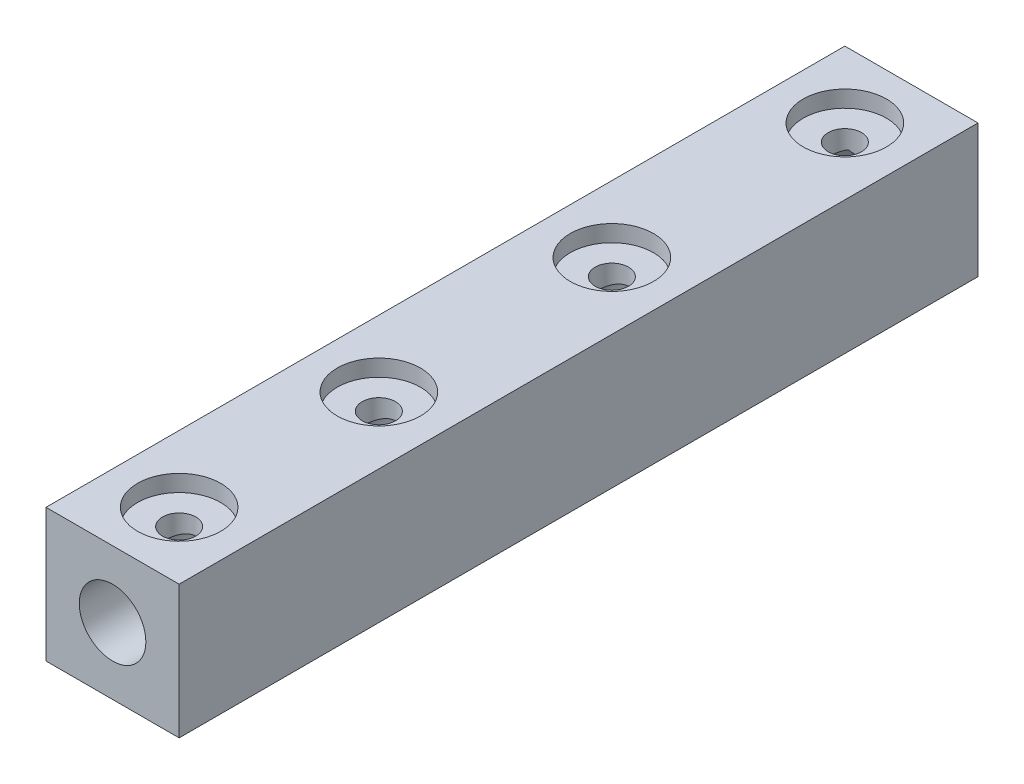
from build123d import *

# Parameters (mm, degrees)
SKETCH18_W                     = 25.4
SKETCH18_H                     = 25.4
BOSS_EXTRUDE3_DEPTH            = 76.2
F_1_2_0_5_DIAMETER_HOLE2_D     = 12.7
F_1_2_0_5_DIAMETER_HOLE2_DEPTH = 142.234535069
F_1_2_0_5_DIAMETER_HOLE2_TIP   = 3.815464931
SKETCH26_R                     = 3.175
CUT_EXTRUDE10_DEPTH            = 12.7
SKETCH27_R                     = 7.9375
CUT_EXTRUDE11_DEPTH            = 3.175
CUT_EXTRUDE12_START            = -12.7
SKETCH28_R                     = 3.175
CUT_EXTRUDE12_DEPTH            = 12.7
CUT_EXTRUDE13_START            = -3.175
SKETCH29_R                     = 7.9375
CUT_EXTRUDE13_DEPTH            = 3.175


with BuildPart() as part:
    # Sketch18 → Boss-Extrude3 (new, symmetric)
    with BuildSketch(Plane.XY):
        Rectangle(SKETCH18_W, SKETCH18_H)
    extrude(amount=BOSS_EXTRUDE3_DEPTH, both=True)

    # 1/2 (0.5) Diameter Hole2
    with Locations(Plane.XY.offset(76.2)):
        with Locations((0, 0)):
            Hole(F_1_2_0_5_DIAMETER_HOLE2_D / 2, depth=F_1_2_0_5_DIAMETER_HOLE2_DEPTH)
            with Locations((0, 0, -(F_1_2_0_5_DIAMETER_HOLE2_DEPTH + F_1_2_0_5_DIAMETER_HOLE2_TIP / 2))):  # 118° drill point
                Cone(0, F_1_2_0_5_DIAMETER_HOLE2_D / 2, F_1_2_0_5_DIAMETER_HOLE2_TIP, mode=Mode.SUBTRACT)

    # Sketch26 → Cut-Extrude10 (cut)
    with BuildSketch(Plane(origin=(0, 12.7, 0), x_dir=(1, 0, 0), z_dir=(0, 1, 0))):
        with Locations((0, -63.5)):
            Circle(SKETCH26_R)
        with Locations((0, -25.4)):
            Circle(SKETCH26_R)
        with Locations((0, 19.05)):
            Circle(SKETCH26_R)
        with Locations((0, 63.5)):
            Circle(SKETCH26_R)
    extrude(amount=-CUT_EXTRUDE10_DEPTH, mode=Mode.SUBTRACT)

    # Sketch27 → Cut-Extrude11 (cut)
    with BuildSketch(Plane(origin=(0, 12.7, 0), x_dir=(1, 0, 0), z_dir=(0, 1, 0))):
        with Locations((0, 63.5)):
            Circle(SKETCH27_R)
        with Locations((0, 19.05)):
            Circle(SKETCH27_R)
        with Locations((0, -25.4)):
            Circle(SKETCH27_R)
        with Locations((0, -63.5)):
            Circle(SKETCH27_R)
    extrude(amount=-CUT_EXTRUDE11_DEPTH, mode=Mode.SUBTRACT)

    # Sketch28 → Cut-Extrude12 (cut)
    with BuildSketch(Plane.XZ.offset(12.7).offset(CUT_EXTRUDE12_START)):
        with Locations((0, 25.4)):
            Circle(SKETCH28_R)
    extrude(amount=CUT_EXTRUDE12_DEPTH, mode=Mode.SUBTRACT)

    # Sketch29 → Cut-Extrude13 (cut)
    with BuildSketch(Plane(origin=(0, -12.7, 0), x_dir=(-1, 0, 0), z_dir=(0, -1, 0)).offset(CUT_EXTRUDE13_START)):
        with Locations((0, -25.4)):
            Circle(SKETCH29_R)
    extrude(amount=CUT_EXTRUDE13_DEPTH, mode=Mode.SUBTRACT)


solid = part.part
